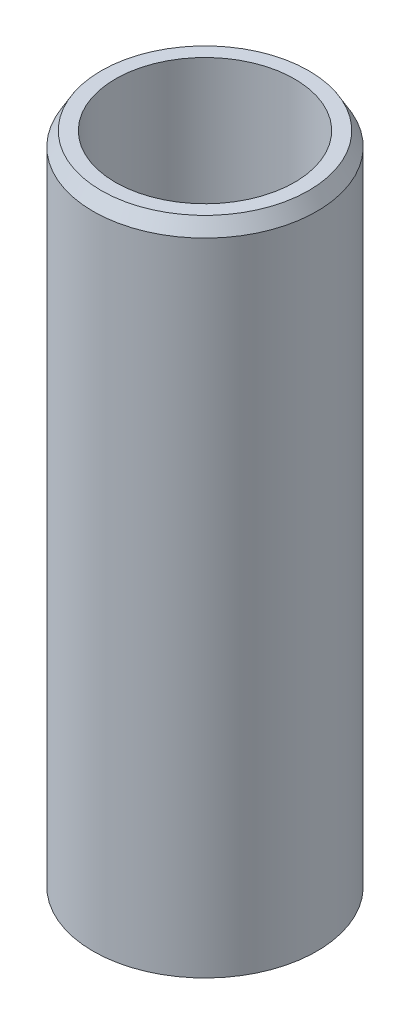
from build123d import *
from OCP.BRepFilletAPI import BRepFilletAPI_MakeChamfer

# Parameters (mm, degrees)
SKETCH1_R           = 45
BOSS_EXTRUDE1_DEPTH = 266.603887036
SKETCH2_R           = 36.03909843
CUT_EXTRUDE1_DEPTH  = 275.094203847
CHAMFER1_SIZE       = 5.629854498
CHAMFER1_SIZE2      = 3.25039801


with BuildPart() as part:
    # Sketch1 → Boss-Extrude1 (new body)
    with BuildSketch(Plane(origin=(0, 0, 0), x_dir=(1, 0, 0), z_dir=(0, 1, 0))):
        Circle(SKETCH1_R)
    extrude(amount=BOSS_EXTRUDE1_DEPTH)

    # Sketch2 → Cut-Extrude1 (cut, through all)
    with BuildSketch(Plane(origin=(0, 0, 0), x_dir=(1, 0, 0), z_dir=(0, 1, 0))):
        Circle(SKETCH2_R)
    extrude(amount=CUT_EXTRUDE1_DEPTH, mode=Mode.SUBTRACT)

    # Chamfer1: one chamfer whose edges measure the first distance from different faces: ONE call of the kernel's chamfer builder (chamfer() names one face for all edges)
    chamfer1_edges_1 = [part.edges().sort_by_distance(p)[0] for p in [
        (-45, 266.603887036, 0),
    ]]
    chamfer1_side_1 = [part.faces().sort_by_distance(p)[0] for p in [
        (-45, 133.301943518, 0),
    ]]
    chamfer1_edges_2 = [part.edges().sort_by_distance(p)[0] for p in [
        (-45, 0, 0),
    ]]
    chamfer1_side_2 = [part.faces().sort_by_distance(p)[0] for p in [
        (-43.727207794, 0, 0),
    ]]
    chamfer1 = BRepFilletAPI_MakeChamfer(part.part.solid().wrapped)
    for e in chamfer1_edges_1:
        chamfer1.Add(CHAMFER1_SIZE, CHAMFER1_SIZE2, e.wrapped, chamfer1_side_1[0].wrapped)  # the first distance lies on this face
    for e in chamfer1_edges_2:
        chamfer1.Add(CHAMFER1_SIZE, CHAMFER1_SIZE2, e.wrapped, chamfer1_side_2[0].wrapped)  # the first distance lies on this face
    add(Compound.cast(chamfer1.Shape()), mode=Mode.REPLACE)


solid = part.part
